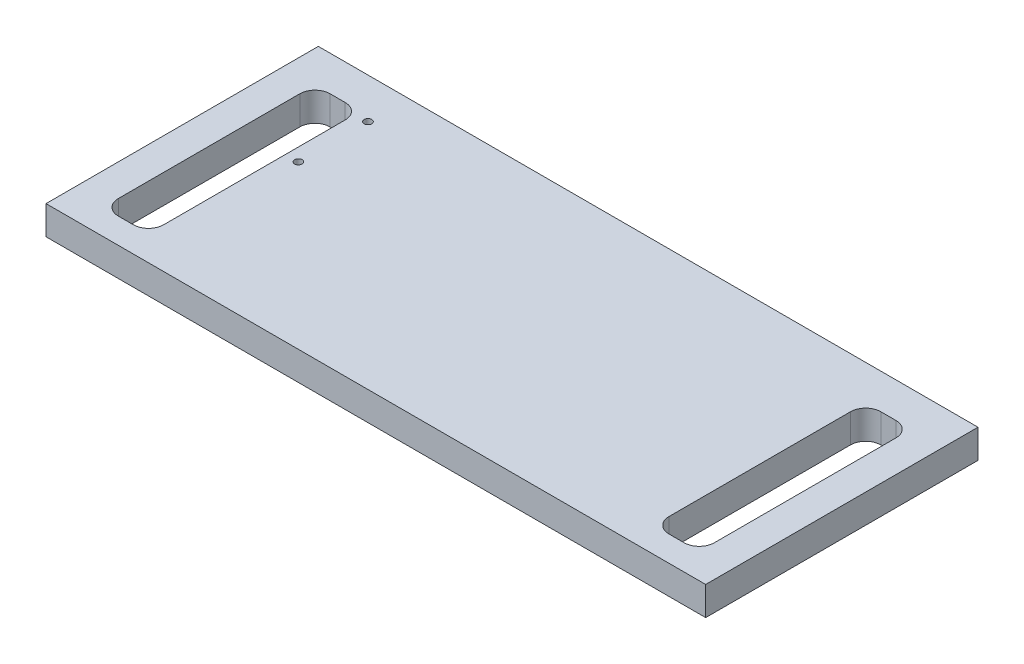
from build123d import *

# Parameters (mm, degrees)
SKETCH_1_W          = 218
SKETCH_1_H          = 90
EXTRUDE_1_DEPTH     = 9.5
SKETCH_2_W          = 15
SKETCH_2_H          = 70
CUT_EXTRUDE_1_DEPTH = 119.305747958
FILLET_1_R          = 5
FILLET_2_R          = 5
SKETCH_3_R          = 1.25
CUT_EXTRUDE_2_DEPTH = 119.305747958


with BuildPart() as part:
    # 草图1 → 凸台-拉伸1 (new body)
    with BuildSketch(Plane(origin=(0, 0, 0), x_dir=(1, 0, 0), z_dir=(0, 1, 0))):
        Rectangle(SKETCH_1_W, SKETCH_1_H)
    extrude(amount=EXTRUDE_1_DEPTH)

    # 草图2 → 切除-拉伸1 (cut, through all)
    with BuildSketch(Plane(origin=(0, 9.5, 0), x_dir=(1, 0, 0), z_dir=(0, 1, 0))):
        with Locations((-91, -1.623091192)):
            Rectangle(SKETCH_2_W, SKETCH_2_H)
        with Locations((91, -1.623091192)):
            Rectangle(SKETCH_2_W, SKETCH_2_H)
    extrude(amount=-CUT_EXTRUDE_1_DEPTH, mode=Mode.SUBTRACT)

    # 圆角1
    fillet_1_edges = [part.edges().sort_by_distance(p)[0] for p in [
        (-98.5, 4.75, 36.623091192),
        (-83.5, 4.75, 36.623091192),
        (-83.5, 4.75, -33.376908808),
        (-98.5, 4.75, -33.376908808),
    ]]
    fillet(fillet_1_edges, radius=FILLET_1_R)

    # 圆角2
    fillet_2_edges = [part.edges().sort_by_distance(p)[0] for p in [
        (98.5, 4.75, -33.376908808),
        (83.5, 4.75, -33.376908808),
        (83.5, 4.75, 36.623091192),
        (98.5, 4.75, 36.623091192),
    ]]
    fillet(fillet_2_edges, radius=FILLET_2_R)

    # 草图3 → 切除-拉伸2 (cut, through all)
    with BuildSketch(Plane(origin=(0, 9.5, 0), x_dir=(1, 0, 0), z_dir=(0, 1, 0))):
        with Locations((-79.25, 8.65)):
            Circle(SKETCH_3_R)
        with Locations((-79.25, 31.65)):
            Circle(SKETCH_3_R)
    extrude(amount=-CUT_EXTRUDE_2_DEPTH, mode=Mode.SUBTRACT)


solid = part.part
